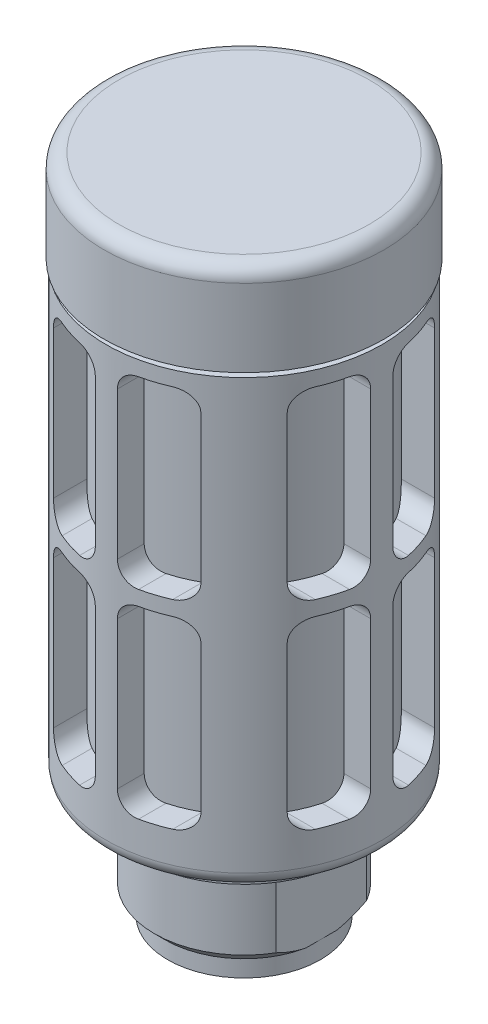
from build123d import *

# Parameters (mm, degrees)
CUT_EXTRUDE1_DEPTH      = 20
CUT_EXTRUDE1_DEPTH_BACK = 20
CUT_EXTRUDE2_DEPTH      = 20
CUT_EXTRUDE2_DEPTH_BACK = 20
CUT_EXTRUDE3_DEPTH      = 20
CUT_EXTRUDE3_DEPTH_BACK = 20
CUT_EXTRUDE4_DEPTH      = 20
CUT_EXTRUDE4_DEPTH_BACK = 20
CUT_EXTRUDE5_DEPTH      = 20
CUT_EXTRUDE5_DEPTH_BACK = 20
CUT_EXTRUDE6_DEPTH      = 20
CUT_EXTRUDE6_DEPTH_BACK = 20
CUT_EXTRUDE7_DEPTH      = 20
CUT_EXTRUDE7_DEPTH_BACK = 20
CUT_EXTRUDE8_DEPTH      = 20
CUT_EXTRUDE8_DEPTH_BACK = 20
CUT_EXTRUDE9_DEPTH      = 15
CUT_EXTRUDE9_DEPTH_BACK = 15


with BuildPart() as part:
    # Sketch1 → Revolve1 (revolve)
    with BuildSketch(Plane.XY):
        with BuildLine():
            Line((0, 34.9), (-6.05, 34.9))
            Line((-6.05, 34.9), (-6.05, 7.8))
            Line((-6.05, 7.8), (-3.2, 7.8))
            Line((-3.2, 7.8), (-3.2, 0.4))
            Line((-3.2, 0.4), (-3.6, 0))
            Line((-3.6, 0), (-4.15, 0))
            Line((-4.15, 0), (-4.15, 1))
            Line((-4.15, 1), (-4.283, 1))
            Line((-4.283, 1), (-4.864, 1.581))
            Line((-4.864, 1.581), (-4.864, 5.5))
            Line((-4.864, 5.5), (-5.7, 5.5))
            Line((-5.7, 5.5), (-5.7, 6.1))
            ThreePointArc((-5.7, 6.1), (-5.817157288, 6.382842712), (-6.1, 6.5))
            Line((-6.1, 6.5), (-6.7, 6.5))
            ThreePointArc((-6.7, 6.5), (-7.265685425, 6.734314575), (-7.5, 7.3))
            Line((-7.5, 7.3), (-7.5, 30.6))
            Line((-7.5, 30.6), (-7, 30.6))
            ThreePointArc((-7, 30.6), (-6.858578644, 30.658578644), (-6.8, 30.8))
            Line((-6.8, 30.8), (-6.8, 30.9))
            Line((-6.8, 30.9), (-7.6, 30.9))
            Line((-7.6, 30.9), (-7.6, 35.1))
            ThreePointArc((-7.6, 35.1), (-7.365685425, 35.665685425), (-6.8, 35.9))
            Line((-6.8, 35.9), (0, 35.9))
            Line((0, 35.9), (0, 34.9))
        make_face()
    revolve(axis=Axis((0, 35.9, 0), (0, -1, 0)))

    # Sketch2 → Cut-Extrude1 (cut, two sides: drawn at the far end of the back side and taken through both)
    with BuildSketch(Plane.XY.offset(-CUT_EXTRUDE1_DEPTH_BACK)):
        with BuildLine():
            Line((1.6, 19.8), (3, 19.8))
            ThreePointArc((3, 19.8), (3.707106781, 20.092893219), (4, 20.8))
            Line((4, 20.8), (4, 28.8))
            ThreePointArc((4, 28.8), (3.707106781, 29.507106781), (3, 29.8))
            Line((3, 29.8), (1.6, 29.8))
            ThreePointArc((1.6, 29.8), (0.892893219, 29.507106781), (0.6, 28.8))
            Line((0.6, 28.8), (0.6, 20.8))
            ThreePointArc((0.6, 20.8), (0.892893219, 20.092893219), (1.6, 19.8))
        make_face()
    extrude(amount=CUT_EXTRUDE1_DEPTH + CUT_EXTRUDE1_DEPTH_BACK, mode=Mode.SUBTRACT)

    # Sketch3 → Cut-Extrude2 (cut, two sides: drawn at the far end of the back side and taken through both)
    with BuildSketch(Plane.XY.offset(-CUT_EXTRUDE2_DEPTH_BACK)):
        with BuildLine():
            Line((1.6, 9), (3, 9))
            ThreePointArc((3, 9), (3.707106781, 9.292893219), (4, 10))
            Line((4, 10), (4, 18))
            ThreePointArc((4, 18), (3.707106781, 18.707106781), (3, 19))
            Line((3, 19), (1.6, 19))
            ThreePointArc((1.6, 19), (0.892893219, 18.707106781), (0.6, 18))
            Line((0.6, 18), (0.6, 10))
            ThreePointArc((0.6, 10), (0.892893219, 9.292893219), (1.6, 9))
        make_face()
    extrude(amount=CUT_EXTRUDE2_DEPTH + CUT_EXTRUDE2_DEPTH_BACK, mode=Mode.SUBTRACT)

    # Sketch4 → Cut-Extrude3 (cut, two sides: drawn at the far end of the back side and taken through both)
    with BuildSketch(Plane.XY.offset(-CUT_EXTRUDE3_DEPTH_BACK)):
        with BuildLine():
            Line((-3, 19.8), (-1.6, 19.8))
            ThreePointArc((-1.6, 19.8), (-0.892893219, 20.092893219), (-0.6, 20.8))
            Line((-0.6, 20.8), (-0.6, 28.8))
            ThreePointArc((-0.6, 28.8), (-0.892893219, 29.507106781), (-1.6, 29.8))
            Line((-1.6, 29.8), (-3, 29.8))
            ThreePointArc((-3, 29.8), (-3.707106781, 29.507106781), (-4, 28.8))
            Line((-4, 28.8), (-4, 20.8))
            ThreePointArc((-4, 20.8), (-3.707106781, 20.092893219), (-3, 19.8))
        make_face()
    extrude(amount=CUT_EXTRUDE3_DEPTH + CUT_EXTRUDE3_DEPTH_BACK, mode=Mode.SUBTRACT)

    # Sketch5 → Cut-Extrude4 (cut, two sides: drawn at the far end of the back side and taken through both)
    with BuildSketch(Plane.XY.offset(-CUT_EXTRUDE4_DEPTH_BACK)):
        with BuildLine():
            Line((-3, 9), (-1.6, 9))
            ThreePointArc((-1.6, 9), (-0.892893219, 9.292893219), (-0.6, 10))
            Line((-0.6, 10), (-0.6, 18))
            ThreePointArc((-0.6, 18), (-0.892893219, 18.707106781), (-1.6, 19))
            Line((-1.6, 19), (-3, 19))
            ThreePointArc((-3, 19), (-3.707106781, 18.707106781), (-4, 18))
            Line((-4, 18), (-4, 10))
            ThreePointArc((-4, 10), (-3.707106781, 9.292893219), (-3, 9))
        make_face()
    extrude(amount=CUT_EXTRUDE4_DEPTH + CUT_EXTRUDE4_DEPTH_BACK, mode=Mode.SUBTRACT)

    # Sketch6 → Cut-Extrude5 (cut, two sides: drawn at the far end of the back side and taken through both)
    with BuildSketch(Plane(origin=(0, 0, 0), x_dir=(0, 0, -1), z_dir=(1, 0, 0)).offset(-CUT_EXTRUDE5_DEPTH_BACK)):
        with BuildLine():
            Line((-3, 19.8), (-1.6, 19.8))
            ThreePointArc((-1.6, 19.8), (-0.892893219, 20.092893219), (-0.6, 20.8))
            Line((-0.6, 20.8), (-0.6, 28.8))
            ThreePointArc((-0.6, 28.8), (-0.892893219, 29.507106781), (-1.6, 29.8))
            Line((-1.6, 29.8), (-3, 29.8))
            ThreePointArc((-3, 29.8), (-3.707106781, 29.507106781), (-4, 28.8))
            Line((-4, 28.8), (-4, 20.8))
            ThreePointArc((-4, 20.8), (-3.707106781, 20.092893219), (-3, 19.8))
        make_face()
    extrude(amount=CUT_EXTRUDE5_DEPTH + CUT_EXTRUDE5_DEPTH_BACK, mode=Mode.SUBTRACT)

    # Sketch7 → Cut-Extrude6 (cut, two sides: drawn at the far end of the back side and taken through both)
    with BuildSketch(Plane(origin=(0, 0, 0), x_dir=(0, 0, -1), z_dir=(1, 0, 0)).offset(-CUT_EXTRUDE6_DEPTH_BACK)):
        with BuildLine():
            Line((-3, 9), (-1.6, 9))
            ThreePointArc((-1.6, 9), (-0.892893219, 9.292893219), (-0.6, 10))
            Line((-0.6, 10), (-0.6, 18))
            ThreePointArc((-0.6, 18), (-0.892893219, 18.707106781), (-1.6, 19))
            Line((-1.6, 19), (-3, 19))
            ThreePointArc((-3, 19), (-3.707106781, 18.707106781), (-4, 18))
            Line((-4, 18), (-4, 10))
            ThreePointArc((-4, 10), (-3.707106781, 9.292893219), (-3, 9))
        make_face()
    extrude(amount=CUT_EXTRUDE6_DEPTH + CUT_EXTRUDE6_DEPTH_BACK, mode=Mode.SUBTRACT)

    # Sketch8 → Cut-Extrude7 (cut, two sides: drawn at the far end of the back side and taken through both)
    with BuildSketch(Plane(origin=(0, 0, 0), x_dir=(0, 0, -1), z_dir=(1, 0, 0)).offset(-CUT_EXTRUDE7_DEPTH_BACK)):
        with BuildLine():
            Line((1.6, 19.8), (3, 19.8))
            ThreePointArc((3, 19.8), (3.707106781, 20.092893219), (4, 20.8))
            Line((4, 20.8), (4, 28.8))
            ThreePointArc((4, 28.8), (3.707106781, 29.507106781), (3, 29.8))
            Line((3, 29.8), (1.6, 29.8))
            ThreePointArc((1.6, 29.8), (0.892893219, 29.507106781), (0.6, 28.8))
            Line((0.6, 28.8), (0.6, 20.8))
            ThreePointArc((0.6, 20.8), (0.892893219, 20.092893219), (1.6, 19.8))
        make_face()
    extrude(amount=CUT_EXTRUDE7_DEPTH + CUT_EXTRUDE7_DEPTH_BACK, mode=Mode.SUBTRACT)

    # Sketch9 → Cut-Extrude8 (cut, two sides: drawn at the far end of the back side and taken through both)
    with BuildSketch(Plane(origin=(0, 0, 0), x_dir=(0, 0, -1), z_dir=(1, 0, 0)).offset(-CUT_EXTRUDE8_DEPTH_BACK)):
        with BuildLine():
            Line((1.6, 9), (3, 9))
            ThreePointArc((3, 9), (3.707106781, 9.292893219), (4, 10))
            Line((4, 10), (4, 18))
            ThreePointArc((4, 18), (3.707106781, 18.707106781), (3, 19))
            Line((3, 19), (1.6, 19))
            ThreePointArc((1.6, 19), (0.892893219, 18.707106781), (0.6, 18))
            Line((0.6, 18), (0.6, 10))
            ThreePointArc((0.6, 10), (0.892893219, 9.292893219), (1.6, 9))
        make_face()
    extrude(amount=CUT_EXTRUDE8_DEPTH + CUT_EXTRUDE8_DEPTH_BACK, mode=Mode.SUBTRACT)

    # Sketch10 → Cut-Extrude9 (cut, two sides: drawn at the far end of the back side and taken through both)
    with BuildSketch(Plane.XY.offset(-CUT_EXTRUDE9_DEPTH_BACK)):
        Polygon((-6.2, -11.5), (6.2, -11.5), (6.2, 5.5), (4.2, 5.5), (4.2, -9.5), (-4.2, -9.5), (-4.2, 5.5), (-6.2, 5.5), align=None)
    extrude(amount=CUT_EXTRUDE9_DEPTH + CUT_EXTRUDE9_DEPTH_BACK, mode=Mode.SUBTRACT)

    # Sketch11 → Revolve2 (revolve)
    with BuildSketch(Plane.XY):
        with BuildLine():
            Line((0, 32.2), (-2.2, 32.2))
            ThreePointArc((-2.2, 32.2), (-2.907106781, 31.907106781), (-3.2, 31.2))
            Line((-3.2, 31.2), (-3.2, 7.8))
            Line((-3.2, 7.8), (-6.05, 7.8))
            Line((-6.05, 7.8), (-6.05, 34.9))
            Line((-6.05, 34.9), (0, 34.9))
            Line((0, 34.9), (0, 32.2))
        make_face()
    revolve(axis=Axis((0, 34.9, 0), (0, -1, 0)))


solid = part.part
